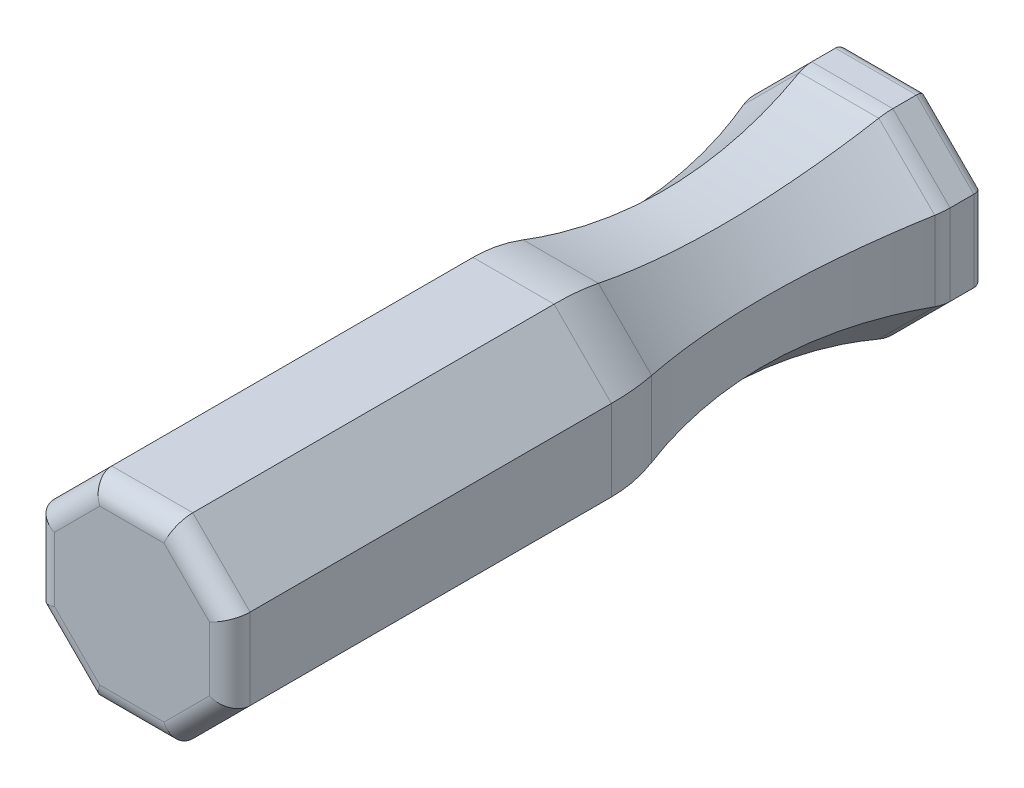
from build123d import *

# Parameters (mm, degrees)
CUT_SWEEP1_START   = -10.440114653
CUT_SWEEP1_DEPTH   = 20.880229306
CIRPATTERN1_COUNT  = 8
SKETCH5_R          = 7.9375
CUT_EXTRUDE1_DEPTH = 68.58
FILLET1_R          = 1.5875
FILLET2_R          = 3.175
FILLET3_R          = 25.4
FILLET4_R          = 6.35


# Read off the part's stored shape, not the designer's step: Cut-Sweep1
with BuildPart() as part:
    # Sweep2: sweep along a path in Sketch3
    with BuildLine(Plane(origin=(0, 0, 0), x_dir=(0, 0, -1), z_dir=(1, 0, 0))) as sweep2_path:
        Line((0, 0), (117.475, 0))
    # Sketch1 → Sweep2 (sweep)
    with BuildSketch(Plane.XY):
        Polygon((15.24, -6.312614691), (15.24, 6.312614691), (6.312614691, 15.24), (-6.312614691, 15.24), (-15.24, 6.312614691), (-15.24, -6.312614691), (-6.312614691, -15.24), (6.312614691, -15.24), align=None)
    sweep(path=sweep2_path.line)

    # Cut-Sweep1 outline → Cut-Sweep1 (cut)
    with BuildSketch(Plane.YZ.offset(CUT_SWEEP1_START)):
        with BuildLine():
            Line((15.24, -111.125), (15.24, -63.5))
            add(Edge.make_bspline(
                [(15.24, -63.5), (12.515117075, -71.124082686), (11.1125, -79.21695815), (11.1125, -95.40804185), (12.515117075, -103.500917314), (15.24, -111.125)],
                knots=[0, 0, 0, 0, 0.5, 0.5, 1, 1, 1, 1], degree=3))
        make_face()
    cut_sweep1 = extrude(amount=CUT_SWEEP1_DEPTH, mode=Mode.SUBTRACT)

    # CirPattern1: Cut-Sweep1 ×8 about axis
    cirpattern1_axis = Axis((0, 0, 0), (0, 0, -1))
    for i in range(1, CIRPATTERN1_COUNT):
        add(cut_sweep1.rotate(cirpattern1_axis, i * 360 / CIRPATTERN1_COUNT), mode=Mode.SUBTRACT)

    # Sketch5 → Cut-Extrude1 (cut)
    with BuildSketch(Plane(origin=(0, 0, -117.475), x_dir=(-1, 0, 0), z_dir=(0, 0, -1))):
        Circle(SKETCH5_R)
    extrude(amount=-CUT_EXTRUDE1_DEPTH, mode=Mode.SUBTRACT)

    # Fillet1
    fillet1_edges = [part.edges().sort_by_distance(p)[0] for p in [
        (10.776307345, -10.776307345, -117.475),
        (15.24, 0, -117.475),
        (10.776307345, 10.776307345, -117.475),
        (0, 15.24, -117.475),
        (-10.776307345, 10.776307345, -117.475),
        (-15.24, 0, -117.475),
        (-10.776307345, -10.776307345, -117.475),
        (0, -15.24, -117.475),
    ]]
    fillet(fillet1_edges, radius=FILLET1_R)

    # Fillet2
    fillet2_edges = [part.edges().sort_by_distance(p)[0] for p in [
        (15.24, 0, 0),
        (10.776307345, 10.776307345, 0),
        (0, 15.24, 0),
        (-10.776307345, 10.776307345, 0),
        (-15.24, 0, 0),
        (-10.776307345, -10.776307345, 0),
        (0, -15.24, 0),
        (10.776307345, -10.776307345, 0),
    ]]
    fillet(fillet2_edges, radius=FILLET2_R)

    # Fillet3
    fillet3_edges = [part.edges().sort_by_distance(p)[0] for p in [
        (10.776307345, 10.776307345, -63.5),
        (15.24, 0, -63.5),
        (10.776307345, -10.776307345, -63.5),
        (0, -15.24, -63.5),
        (-10.776307345, -10.776307345, -63.5),
        (-15.24, 0, -63.5),
        (-10.776307345, 10.776307345, -63.5),
        (0, 15.24, -63.5),
    ]]
    fillet(fillet3_edges, radius=FILLET3_R)

    # Fillet4
    fillet4_edges = [part.edges().sort_by_distance(p)[0] for p in [
        (-10.776307345, -10.776307345, -111.125),
        (0, -15.24, -111.125),
        (10.776307345, -10.776307345, -111.125),
        (15.24, 0, -111.125),
        (10.776307345, 10.776307345, -111.125),
        (0, 15.24, -111.125),
        (-10.776307345, 10.776307345, -111.125),
        (-15.24, 0, -111.125),
    ]]
    fillet(fillet4_edges, radius=FILLET4_R)


solid = part.part
